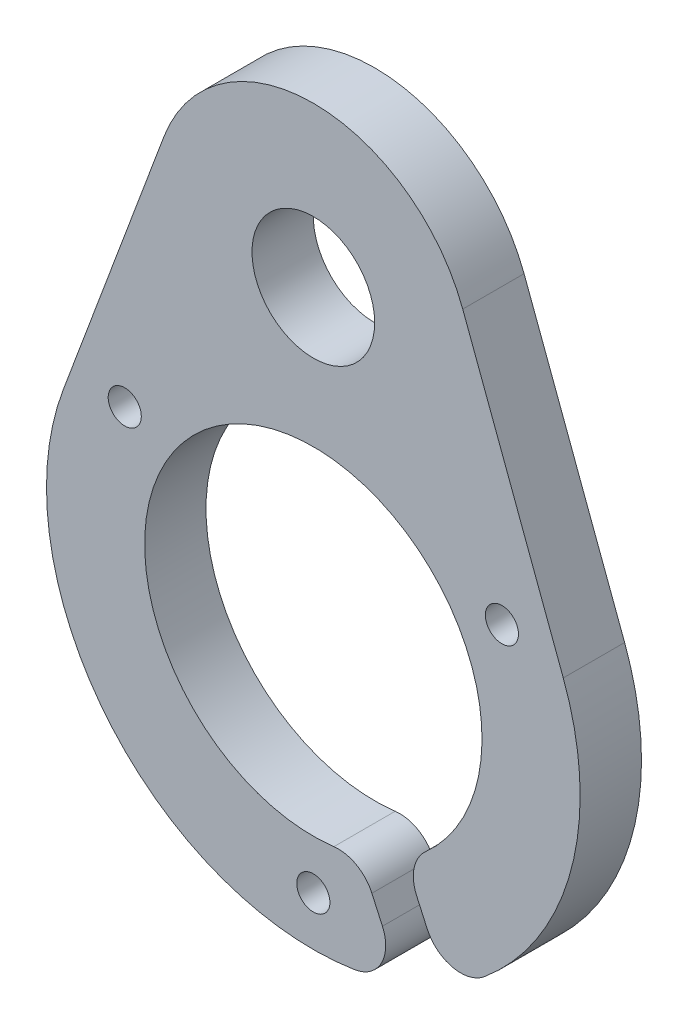
from build123d import *

# Parameters (mm, degrees)
SKETCH1_R           = 5
SKETCH1_R_2         = 1.35
BOSS_EXTRUDE1_DEPTH = 5
CONG_2_R            = 3


with BuildPart() as part:
    # Sketch1 → Boss-Extrude1 (new body)
    with BuildSketch(Plane.XY):
        with BuildLine():
            Line((7.433976594, -11.567129808), (10.756607468, -18.903912182))
            ThreePointArc((10.756607468, -18.903912182), (20.44660049, -7.416132981), (20.37430597, 7.6125))
            Line((20.37430597, 7.6125), (12.177746097, 29.55))
            ThreePointArc((12.177746097, 29.55), (0, 38), (-12.177746097, 29.55))
            Line((-12.177746097, 29.55), (-20.37430597, 7.6125))
            ThreePointArc((-20.37430597, 7.6125), (-15.56616527, -15.190687897), (7.112849411, -20.554071939))
            Line((7.112849411, -20.554071939), (3.790218537, -13.217289565))
            ThreePointArc((3.790218537, -13.217289565), (-5.672424163, 12.525418321), (7.433976594, -11.567129808))
        make_face()
        with Locations((0, 25)):
            Circle(SKETCH1_R, mode=Mode.SUBTRACT)
        with Locations((0, -17.75)):
            Circle(SKETCH1_R_2, mode=Mode.SUBTRACT)
        with Locations((15.371950917, 8.875)):
            Circle(SKETCH1_R_2, mode=Mode.SUBTRACT)
        with Locations((-15.371950917, 8.875)):
            Circle(SKETCH1_R_2, mode=Mode.SUBTRACT)
    extrude(amount=BOSS_EXTRUDE1_DEPTH)

    # Congé2
    cong_2_edges = [part.edges().sort_by_distance(p)[0] for p in [
        (10.756607468, -18.903912182, 2.5),
        (3.790218537, -13.217289565, 2.5),
        (7.433976594, -11.567129808, 2.5),
        (7.112849411, -20.554071939, 2.5),
    ]]
    fillet(cong_2_edges, radius=CONG_2_R)


solid = part.part
